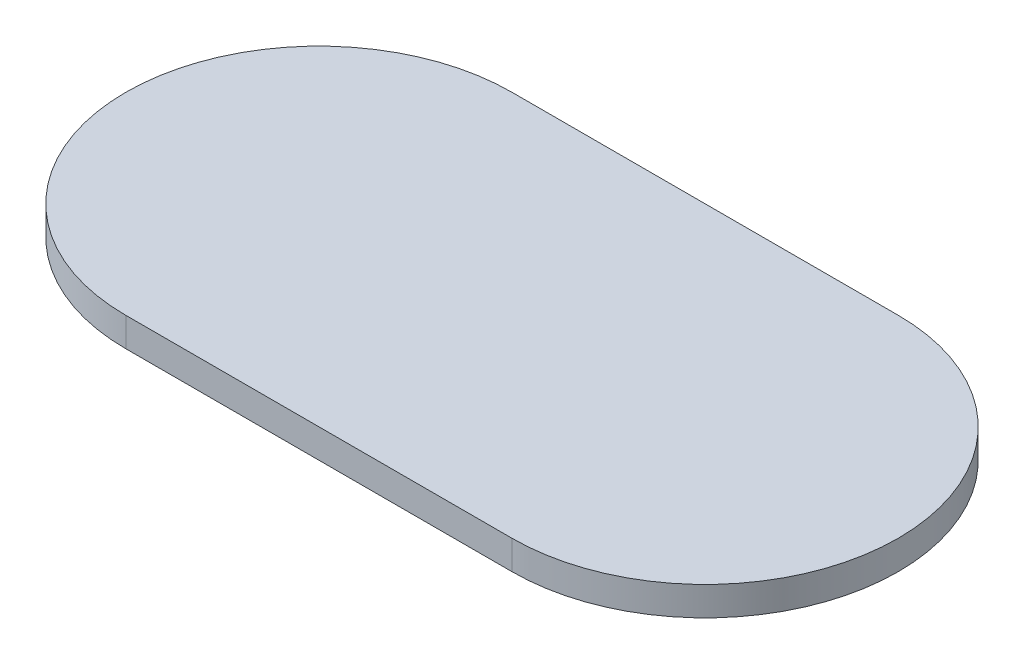
from build123d import *

# Parameters (mm, degrees)
BOSS_EXTRUDE1_DEPTH = 3.81


with BuildPart() as part:
    # Sketch1 → Boss-Extrude1 (new body)
    with BuildSketch(Plane(origin=(0, 0, 0), x_dir=(1, 0, 0), z_dir=(0, 1, 0))):
        with BuildLine():
            Line((-25.4, -25.4), (25.4, -25.4))
            ThreePointArc((25.4, -25.4), (50.8, 0), (25.4, 25.4))
            Line((25.4, 25.4), (-25.4, 25.4))
            ThreePointArc((-25.4, 25.4), (-50.8, 0), (-25.4, -25.4))
        make_face()
    extrude(amount=BOSS_EXTRUDE1_DEPTH)


solid = part.part
